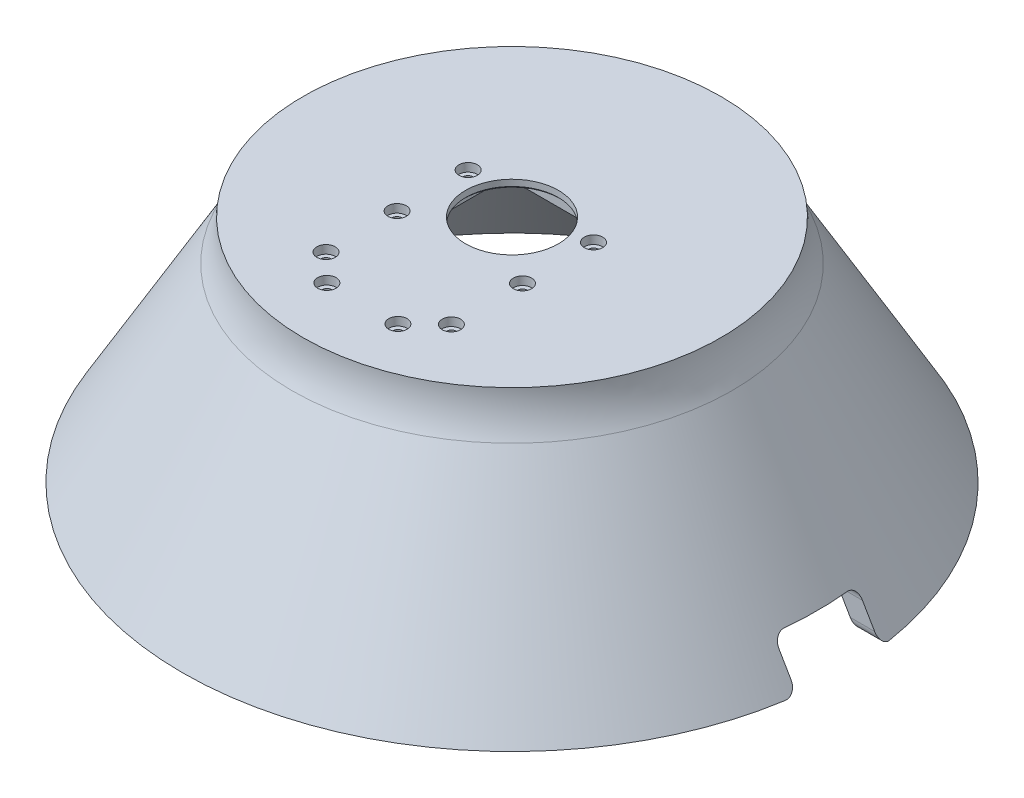
from build123d import *

# Parameters (mm, degrees)
SKETCH1_R                      = 50
BOSS_EXTRUDE1_DEPTH            = 5
SKETCH2_R                      = 50
BOSS_EXTRUDE2_DEPTH            = 50
BOSS_EXTRUDE2_DRAFT            = -30
FILLET1_R                      = 20
SHELL1_T                       = -5
CUT_EXTRUDE1_DEPTH             = 123.229985513
CUT_EXTRUDE1_DEPTH_BACK        = 123.229985513
SKETCH3_W                      = 20
SKETCH3_H                      = 20
FILLET2_R                      = 2.5
CUT_EXTRUDE3_DEPTH             = 124.76157367
CUT_EXTRUDE3_DEPTH_BACK        = 124.76157367
SKETCH5_R                      = 11.1
CUT_EXTRUDE4_DEPTH             = 1
CUT_EXTRUDE5_DEPTH             = 3
CHAMFER1_SIZE                  = 0.5
CBORE_FOR_M2_SHCS1_D           = 2.4
CBORE_FOR_M2_SHCS1_DEPTH       = 8
CBORE_FOR_M2_SHCS1_CBORE_D     = 4.4
CBORE_FOR_M2_SHCS1_CBORE_DEPTH = 2
CBORE_FOR_M2_SHCS1_TIP         = 0.721032743
CHAMFER2_SIZE                  = 0.5


with BuildPart() as part:
    # Sketch1 → Boss-Extrude1 (new body)
    with BuildSketch(Plane(origin=(0, 0, 0), x_dir=(1, 0, 0), z_dir=(0, 1, 0))):
        with Locations(Location((0, 0, 0), (0, 0, 270))):
            Circle(SKETCH1_R)
    extrude(amount=BOSS_EXTRUDE1_DEPTH)


with BuildPart() as boss_extrude2_tool:
    # Sketch2 → Boss-Extrude2 (with draft: the straight prism first)
    with BuildSketch(Plane.XZ):
        with Locations(Location((0, 0, 0), (0, 0, 270))):
            Circle(SKETCH2_R)
    extrude(amount=BOSS_EXTRUDE2_DEPTH)
    # Boss-Extrude2: the draft: its side faces are tilted about the plane it starts from
    boss_extrude2_sides = [boss_extrude2_tool.faces().sort_by_distance(p)[0] for p in [
        (0, -25, 50),
    ]]
    draft(boss_extrude2_sides, Plane.XZ, BOSS_EXTRUDE2_DRAFT)


with BuildPart() as part_1:
    add(part.part)

    # Boss-Extrude2: add boss_extrude2_tool
    add(boss_extrude2_tool.part)

    # Fillet1
    # the kernel refuses this fillet: 20 mm, written as the material it adds along each edge
    with BuildSketch(Plane(origin=(0, 0, 0), x_dir=(0, 0, 1), z_dir=(-1, 0, 0))) as fillet1_piece_1:
        with BuildLine():
            CenterArc((69.996673749, 5.364745084), FILLET1_R, 181.044975628, 28.955024372)
            Line((50, 5), (49.600066525, 4.992705098))
            ThreePointArc((49.600066525, 4.992705098), (49.6, 2.5), (49.6, 0))
            Line((49.6, 0), (49.653589838, -0.2))
            Line((49.653589838, -0.2), (52.329755512, -4.835254916))
            Line((52.329755512, -4.835254916), (52.676165673, -4.635254916))
        make_face()
    revolve(axis=Axis((0, 0, 0), (0, 1, 0)), revolution_arc=180)
    with BuildSketch(Plane(origin=(0, 0, 0), x_dir=(0, 0, -1), z_dir=(1, 0, 0))) as fillet1_piece_2:
        with BuildLine():
            CenterArc((69.996673749, 5.364745084), FILLET1_R, 181.044975628, 28.955024372)
            Line((50, 5), (49.600066525, 4.992705098))
            ThreePointArc((49.600066525, 4.992705098), (49.6, 2.5), (49.6, 0))
            Line((49.6, 0), (49.653589838, -0.2))
            Line((49.653589838, -0.2), (52.329755512, -4.835254916))
            Line((52.329755512, -4.835254916), (52.676165673, -4.635254916))
        make_face()
    revolve(axis=Axis((0, 0, 0), (0, 1, 0)), revolution_arc=180)

    # Shell1
    shell1_openings = [part_1.faces().sort_by_distance(p)[0] for p in [
        (0, -50, 0),
    ]]
    offset(amount=SHELL1_T, openings=shell1_openings, kind=Kind.INTERSECTION)

    # Sketch3 → Cut-Extrude1 (cut, two sides: drawn at the far end of the back side and taken through both)
    with BuildSketch(Plane(origin=(0, 0, 0), x_dir=(0, 0, -1), z_dir=(1, 0, 0)).offset(-CUT_EXTRUDE1_DEPTH_BACK)):
        with Locations((0, -50)):
            Rectangle(SKETCH3_W, SKETCH3_H)
    extrude(amount=CUT_EXTRUDE1_DEPTH + CUT_EXTRUDE1_DEPTH_BACK, mode=Mode.SUBTRACT)

    # Fillet2
    fillet2_edges = [part_1.edges().sort_by_distance(p)[0] for p in [
        (75.318849558, -50, 10),
        (-75.318849558, -50, 10),
        (69.490189269, -40, 10),
        (-69.490189269, -40, 10),
        (-75.318849558, -50, -10),
        (75.318849558, -50, -10),
        (69.490189269, -40, -10),
        (-69.490189269, -40, -10),
    ]]
    fillet(fillet2_edges, radius=FILLET2_R)

    # Sketch5 → Cut-Extrude3 (cut, two sides: drawn at the far end of the back side and taken through both)
    with BuildSketch(Plane(origin=(0, 5, 0), x_dir=(1, 0, 0), z_dir=(0, 1, 0)).offset(-CUT_EXTRUDE3_DEPTH_BACK)):
        with Locations(Location((0, 0, 0), (0, 0, 270))):
            Circle(SKETCH5_R)
    extrude(amount=CUT_EXTRUDE3_DEPTH + CUT_EXTRUDE3_DEPTH_BACK, mode=Mode.SUBTRACT)

    # Sketch7 → Cut-Extrude4 (cut)
    with BuildSketch(Plane.XZ):
        with BuildLine():
            Line((-13.67469046, 37.607710102), (-17.162011881, 33.504979019))
            ThreePointArc((-17.162011881, 33.504979019), (-17.709659501, 32.566792911), (-17.9, 31.497268912))
            Line((-17.9, 31.497268912), (-17.9, -4.89726891))
            ThreePointArc((-17.9, -4.89726891), (-17.709659503, -5.966792907), (-17.162011885, -6.904979015))
            Line((-17.162011885, -6.904979015), (-13.674690505, -11.007710044))
            ThreePointArc((-13.674690505, -11.007710044), (-12.613850902, -11.813707618), (-11.312678574, -12.099999997))
            Line((-11.312678574, -12.099999997), (-9.199999999, -12.099999997))
            Line((-9.199999999, -12.099999997), (9.199999957, -12.099999997))
            Line((9.199999957, -12.099999997), (11.312678504, -12.099999997))
            ThreePointArc((11.312678504, -12.099999997), (12.613850838, -11.813707649), (13.674690461, -11.0077101))
            Line((13.674690461, -11.0077101), (17.162011881, -6.904979017))
            ThreePointArc((17.162011881, -6.904979017), (17.709659502, -5.966792909), (17.9, -4.89726891))
            Line((17.9, -4.89726891), (17.9, 31.497268912))
            ThreePointArc((17.9, 31.497268912), (17.709659503, 32.566792909), (17.162011885, 33.504979017))
            Line((17.162011885, 33.504979017), (13.674690506, 37.607710046))
            ThreePointArc((13.674690506, 37.607710046), (12.613850902, 38.41370762), (11.312678575, 38.699999999))
            Line((11.312678575, 38.699999999), (-11.312678503, 38.699999999))
            ThreePointArc((-11.312678503, 38.699999999), (-12.613850837, 38.413707651), (-13.67469046, 37.607710102))
        make_face()
    extrude(amount=-CUT_EXTRUDE4_DEPTH, mode=Mode.SUBTRACT)

    # Sketch9 → Cut-Extrude5 (cut)
    with BuildSketch(Plane.XZ):
        with BuildLine():
            Line((12.299999999, -8.999999976), (12.299999999, 29.999999999))
            ThreePointArc((12.299999999, 29.999999999), (11.39203102, 32.19203102), (9.199999999, 33.099999999))
            Line((9.199999999, 33.099999999), (-9.200000001, 33.099999999))
            ThreePointArc((-9.200000001, 33.099999999), (-11.392031031, 32.192031012), (-12.3, 29.999999975))
            Line((-12.3, 29.999999975), (-12.3, -9))
            ThreePointArc((-12.3, -9), (-11.392031021, -11.192031022), (-9.199999998, -12.099999998))
            Line((-9.199999998, -12.099999998), (9.199999957, -12.099999999))
            ThreePointArc((9.199999957, -12.099999999), (11.392031014, -11.192031028), (12.299999999, -8.999999976))
        make_face()
    extrude(amount=-CUT_EXTRUDE5_DEPTH, mode=Mode.SUBTRACT)

    # Chamfer1
    # the kernel refuses this chamfer: 0.5 mm, written as the material it takes off along each edge
    with BuildSketch(Plane(origin=(-11.312678576, 0, 35.600000001), x_dir=(2.3654829504119164e-08, 0, 0.9999999999999997), z_dir=(0.9999999999999997, 0, -2.3654829504119164e-08))) as chamfer1_piece_1:
        Polygon((3.099999999 + CHAMFER1_SIZE, 0), (3.099999999, -CHAMFER1_SIZE), (3.099999999, 0), align=None)
    revolve(axis=Axis((-11.312678576, 0, 35.600000001), (0, -1, 0)), revolution_arc=49.635464782, mode=Mode.SUBTRACT)
    with BuildSketch(Plane(origin=(-13.67469046, 0, 37.607710102), x_dir=(-0.7616512413891626, -0.027495876610586317, 0.6474035551800461), z_dir=(-0.6476484200951095, 0, -0.7619393177598258)), Plane(origin=(13.674690461, 0, -11.0077101), x_dir=(0.7616512414231392, -0.027495876610586376, -0.6474035551400734), z_dir=(0.6476484200551218, 0, 0.7619393177938153))) as chamfer1_piece_2:
        Polygon((CHAMFER1_SIZE * 0.999621916911, CHAMFER1_SIZE * 0.0274958766106), (-CHAMFER1_SIZE * 0.0274958766106, CHAMFER1_SIZE * 0.999621916911), (0, 0), align=None)
    extrude(amount=5.384590331, mode=Mode.SUBTRACT)
    with BuildSketch(Plane(origin=(-14.8, 0, 31.497268912), x_dir=(-0.7619393165352751, 0, 0.6476484215357572), z_dir=(0.6476484215357572, 0, 0.7619393165352751))) as chamfer1_piece_3:
        Polygon((3.1 + CHAMFER1_SIZE, 0), (3.1, -CHAMFER1_SIZE), (3.1, 0), align=None)
    revolve(axis=Axis((-14.8, 0, 31.497268912), (0, -1, 0)), revolution_arc=40.364536681, mode=Mode.SUBTRACT)
    with BuildSketch(Plane(origin=(-17.9, 0, 31.497268912), x_dir=(-0.9996219169112968, -0.027495876610586292, 0), z_dir=(0, 0, -1)), Plane(origin=(17.9, 0, -4.89726891), x_dir=(0.9996219169112968, -0.027495876610586292, 0), z_dir=(0, 0, 1))) as chamfer1_piece_4:
        Polygon((CHAMFER1_SIZE * 0.999621916911, CHAMFER1_SIZE * 0.0274958766106), (-CHAMFER1_SIZE * 0.0274958766106, CHAMFER1_SIZE * 0.999621916911), (0, 0), align=None)
    extrude(amount=36.394537823, mode=Mode.SUBTRACT)
    with BuildSketch(Plane(origin=(-14.8, 0, -4.897268912), x_dir=(-1.0, 0, 6.316108926551964e-10), z_dir=(6.316108926551964e-10, 0, 1.0))) as chamfer1_piece_5:
        Polygon((3.1 + CHAMFER1_SIZE, 0), (3.1, -CHAMFER1_SIZE), (3.1, 0), align=None)
    revolve(axis=Axis((-14.8, 0, -4.897268912), (0, -1, 0)), revolution_arc=40.364536609, mode=Mode.SUBTRACT)
    with BuildSketch(Plane(origin=(-17.162011885, 0, -6.904979015), x_dir=(-0.7616512410387175, -0.02749587661058624, -0.6474035555923345), z_dir=(0.6476484205075538, 0, -0.7619393174092481)), Plane(origin=(17.162011885, 0, 33.504979017), x_dir=(0.7616512410386574, -0.02749587661058638, 0.6474035555924051), z_dir=(-0.6476484205076246, 0, 0.761939317409188))) as chamfer1_piece_6:
        Polygon((CHAMFER1_SIZE * 0.999621916911, CHAMFER1_SIZE * 0.0274958766106), (-CHAMFER1_SIZE * 0.0274958766106, CHAMFER1_SIZE * 0.999621916911), (0, 0), align=None)
    extrude(amount=5.384590264, mode=Mode.SUBTRACT)
    with BuildSketch(Plane(origin=(-11.312678574, 0, -8.999999999), x_dir=(-0.7619393330675861, 0, -0.6476484020859792), z_dir=(-0.6476484020859792, 0, 0.7619393330675861))) as chamfer1_piece_7:
        Polygon((3.099999999 + CHAMFER1_SIZE, 0), (3.099999999, -CHAMFER1_SIZE), (3.099999999, 0), align=None)
    revolve(axis=Axis((-11.312678574, 0, -8.999999999), (0, -1, 0)), revolution_arc=49.635464781, mode=Mode.SUBTRACT)
    with BuildSketch(Plane(origin=(-9.199999998, 0, -12.099999998), x_dir=(-5.3039910926307325e-11, -0.027495876592341074, -0.9996219169117987), z_dir=(1.0, 0, -5.305997200438262e-11))) as chamfer1_piece_8:
        Polygon((CHAMFER1_SIZE * 0.999621916912, CHAMFER1_SIZE * 0.0274958765923), (-CHAMFER1_SIZE * 0.0274958778844, CHAMFER1_SIZE * 0.999621916876), (0, 0), align=None)
    extrude(amount=18.399999955, mode=Mode.SUBTRACT)
    with BuildSketch(Plane(origin=(11.312678577, 0, -8.999999999), x_dir=(-2.3654830077137564e-08, 0, -0.9999999999999997), z_dir=(-0.9999999999999997, 0, 2.3654830077137564e-08))) as chamfer1_piece_9:
        Polygon((3.099999999 + CHAMFER1_SIZE, 0), (3.099999999, -CHAMFER1_SIZE), (3.099999999, 0), align=None)
    revolve(axis=Axis((11.312678577, 0, -8.999999999), (0, -1, 0)), revolution_arc=49.635464782, mode=Mode.SUBTRACT)
    with BuildSketch(Plane(origin=(14.8, 0, -4.89726891), x_dir=(0.7619393164437424, 0, -0.6476484216434427), z_dir=(-0.6476484216434427, 0, -0.7619393164437424))) as chamfer1_piece_10:
        Polygon((3.1 + CHAMFER1_SIZE, 0), (3.1, -CHAMFER1_SIZE), (3.1, 0), align=None)
    revolve(axis=Axis((14.8, 0, -4.89726891), (0, -1, 0)), revolution_arc=40.364536679, mode=Mode.SUBTRACT)
    with BuildSketch(Plane(origin=(14.8, 0, 31.497268914), x_dir=(1.0, 0, -6.322604089027274e-10), z_dir=(-6.322604089027274e-10, 0, -1.0))) as chamfer1_piece_11:
        Polygon((3.1 + CHAMFER1_SIZE, 0), (3.1, -CHAMFER1_SIZE), (3.1, 0), align=None)
    revolve(axis=Axis((14.8, 0, 31.497268914), (0, -1, 0)), revolution_arc=40.364536609, mode=Mode.SUBTRACT)
    with BuildSketch(Plane(origin=(11.312678575, 0, 35.600000001), x_dir=(0.7619393330675913, 0, 0.6476484020859729), z_dir=(0.6476484020859729, 0, -0.7619393330675913))) as chamfer1_piece_12:
        Polygon((3.099999999 + CHAMFER1_SIZE, 0), (3.099999999, -CHAMFER1_SIZE), (3.099999999, 0), align=None)
    revolve(axis=Axis((11.312678575, 0, 35.600000001), (0, -1, 0)), revolution_arc=49.635464781, mode=Mode.SUBTRACT)
    with BuildSketch(Plane(origin=(11.312678575, 0, 38.699999999), x_dir=(0, -0.027495876610586483, 0.9996219169112968), z_dir=(-1, 0, 0))) as chamfer1_piece_13:
        Polygon((CHAMFER1_SIZE * 0.999621916911, CHAMFER1_SIZE * 0.0274958766106), (-CHAMFER1_SIZE * 0.0274958766106, CHAMFER1_SIZE * 0.999621916911), (0, 0), align=None)
    extrude(amount=22.625357078, mode=Mode.SUBTRACT)
    with BuildSketch(Plane(origin=(9.199999999, 1, 33.099999999), x_dir=(0, 0.999621916911297, -0.027495876610582174), z_dir=(-1, 0, 0))) as chamfer1_piece_14:
        Polygon((CHAMFER1_SIZE * 0.999621916911, -CHAMFER1_SIZE * 0.0274958766106), (-CHAMFER1_SIZE * 0.0274958766106, -CHAMFER1_SIZE * 0.999621916911), (0, 0), align=None)
    extrude(amount=18.4, mode=Mode.SUBTRACT)
    with BuildSketch(Plane(origin=(-9.200000001, 1, 30), x_dir=(0, 0, 1), z_dir=(1, 0, 0))) as chamfer1_piece_15:
        Polygon((3.099999999, -CHAMFER1_SIZE), (3.099999999 + CHAMFER1_SIZE, 0), (3.099999999, 0), align=None)
    revolve(axis=Axis((-9.200000001, 1, 30), (0, -1, 0)), revolution_arc=90.00000047, mode=Mode.SUBTRACT)
    with BuildSketch(Plane(origin=(-12.3, 1, 29.999999975), x_dir=(0.027495876610585623, 0.9996219169112968, 0), z_dir=(0, 0, -1)), Plane(origin=(12.299999999, 1, -8.999999976), x_dir=(-0.027495876610585623, 0.9996219169112968, 0), z_dir=(0, 0, 1))) as chamfer1_piece_16:
        Polygon((CHAMFER1_SIZE * 0.999621916911, -CHAMFER1_SIZE * 0.0274958766106), (-CHAMFER1_SIZE * 0.0274958766106, -CHAMFER1_SIZE * 0.999621916911), (0, 0), align=None)
    extrude(amount=38.999999975, mode=Mode.SUBTRACT)
    with BuildSketch(Plane(origin=(9.199999999, 1, 29.999999999), x_dir=(1, 0, 0), z_dir=(0, 0, -1))) as chamfer1_piece_17:
        Polygon((3.1, -CHAMFER1_SIZE), (3.1 + CHAMFER1_SIZE, 0), (3.1, 0), align=None)
    revolve(axis=Axis((9.199999999, 1, 29.999999999), (0, -1, 0)), revolution_arc=90, mode=Mode.SUBTRACT)
    with BuildSketch(Plane(origin=(9.200000001, 1, -9.000000001), x_dir=(-0.40314803301109214, 0, -0.91513477886008), z_dir=(-0.91513477886008, 0, 0.40314803301109214))) as chamfer1_piece_18_section:
        Polygon((3.099999998, -CHAMFER1_SIZE), (3.099999998 + CHAMFER1_SIZE, 0), (3.099999998, 0), align=None)
    chamfer1_piece_18 = revolve(axis=Axis((9.200000001, 1, -9.000000001), (0, -1, 0)), revolution_arc=113.775125783, mode=Mode.PRIVATE)
    chamfer1_piece_18 = split(chamfer1_piece_18, bisect_by=Plane(origin=(11.565169985, 1.24480135, -12.099999997), z_dir=(0, 0, 1)), keep=Keep.TOP, mode=Mode.PRIVATE)
    add(chamfer1_piece_18, mode=Mode.SUBTRACT)
    with BuildSketch(Plane(origin=(-9.200000002, 1, -9), x_dir=(-1.0, 0, 1.4741698912063236e-10), z_dir=(1.4741698912063236e-10, 0, 1.0))) as chamfer1_piece_19_section:
        Polygon((3.099999998, -CHAMFER1_SIZE), (3.099999998 + CHAMFER1_SIZE, 0), (3.099999998, 0), align=None)
    chamfer1_piece_19 = revolve(axis=Axis((-9.200000002, 1, -9), (0, -1, 0)), revolution_arc=113.775124578, mode=Mode.PRIVATE)
    chamfer1_piece_19 = split(chamfer1_piece_19, bisect_by=Plane(origin=(-11.565107571, 1.244801351, -12.099999997), z_dir=(0, 0, 1)), keep=Keep.TOP, mode=Mode.PRIVATE)
    add(chamfer1_piece_19, mode=Mode.SUBTRACT)
    with BuildSketch(Plane(origin=(11.312678504, 0, -12.099999997), x_dir=(0, -0.02749587661058615, -0.9996219169112968), z_dir=(-1, 0, 0))) as chamfer1_piece_20:
        Polygon((CHAMFER1_SIZE * 0.999621916911, -CHAMFER1_SIZE * 0.0274958766106), (-CHAMFER1_SIZE * 0.0274958766106, -CHAMFER1_SIZE * 0.999621916911), (0, 0), align=None)
    extrude(amount=2.112678547, mode=Mode.SUBTRACT)
    with BuildSketch(Plane(origin=(-9.199999998, 0, -12.099999997), x_dir=(0, -0.02749587661058639, -0.9996219169112968), z_dir=(-1, 0, 0))) as chamfer1_piece_21:
        Polygon((CHAMFER1_SIZE * 0.999621916911, -CHAMFER1_SIZE * 0.0274958766106), (-CHAMFER1_SIZE * 0.0274958766106, -CHAMFER1_SIZE * 0.999621916911), (0, 0), align=None)
    extrude(amount=2.112678576, mode=Mode.SUBTRACT)

    # CBORE for M2 SHCS1
    with Locations(Plane(origin=(-15, 5, 12.5), x_dir=(0, 0, 1), z_dir=(0, 1, 0))):
        with Locations((0, 0), (17, 0), (17, 30), (0, 30), (-17, 30), (-17, 0), (23.3, 6.5), (23.3, 23.5)):
            CounterBoreHole(CBORE_FOR_M2_SHCS1_D / 2, CBORE_FOR_M2_SHCS1_CBORE_D / 2, CBORE_FOR_M2_SHCS1_CBORE_DEPTH, depth=CBORE_FOR_M2_SHCS1_DEPTH)
            with Locations((0, 0, -(CBORE_FOR_M2_SHCS1_DEPTH + CBORE_FOR_M2_SHCS1_TIP / 2))):  # 118° drill point
                Cone(0, CBORE_FOR_M2_SHCS1_D / 2, CBORE_FOR_M2_SHCS1_TIP, mode=Mode.SUBTRACT)

    # Chamfer2
    chamfer2_edges = [part_1.edges().sort_by_distance(p)[0] for p in [
        (0, 3, -11.1),
    ]]
    chamfer(chamfer2_edges, length=CHAMFER2_SIZE)


solid = part_1.part
